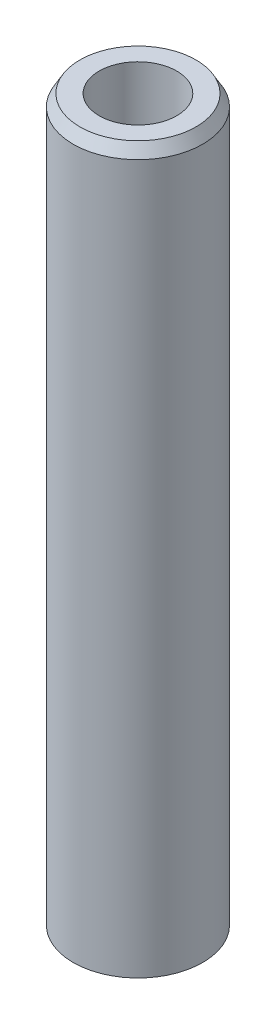
from build123d import *
from OCP.BRepFilletAPI import BRepFilletAPI_MakeChamfer

# Parameters (mm, degrees)
SKETCH1_R           = 30
BOSS_EXTRUDE1_DEPTH = 336.736956736
SKETCH2_R           = 17.9678522
CUT_EXTRUDE1_DEPTH  = 340.39914265
CHAMFER1_SIZE       = 5.389514011
CHAMFER1_SIZE2      = 3.111637365


with BuildPart() as part:
    # Sketch1 → Boss-Extrude1 (new body)
    with BuildSketch(Plane(origin=(0, 0, 0), x_dir=(1, 0, 0), z_dir=(0, 1, 0))):
        Circle(SKETCH1_R)
    extrude(amount=BOSS_EXTRUDE1_DEPTH)

    # Sketch2 → Cut-Extrude1 (cut, through all)
    with BuildSketch(Plane(origin=(0, 0, 0), x_dir=(1, 0, 0), z_dir=(0, 1, 0))):
        Circle(SKETCH2_R)
    extrude(amount=CUT_EXTRUDE1_DEPTH, mode=Mode.SUBTRACT)

    # Chamfer1: one chamfer whose edges measure the first distance from different faces: ONE call of the kernel's chamfer builder (chamfer() names one face for all edges)
    chamfer1_edges_1 = [part.edges().sort_by_distance(p)[0] for p in [
        (-30, 336.736956736, 0),
    ]]
    chamfer1_side_1 = [part.faces().sort_by_distance(p)[0] for p in [
        (-30, 168.368478368, 0),
    ]]
    chamfer1_edges_2 = [part.edges().sort_by_distance(p)[0] for p in [
        (-30, 0, 0),
    ]]
    chamfer1_side_2 = [part.faces().sort_by_distance(p)[0] for p in [
        (-29.151471863, 0, 0),
    ]]
    chamfer1 = BRepFilletAPI_MakeChamfer(part.part.solid().wrapped)
    for e in chamfer1_edges_1:
        chamfer1.Add(CHAMFER1_SIZE, CHAMFER1_SIZE2, e.wrapped, chamfer1_side_1[0].wrapped)  # the first distance lies on this face
    for e in chamfer1_edges_2:
        chamfer1.Add(CHAMFER1_SIZE, CHAMFER1_SIZE2, e.wrapped, chamfer1_side_2[0].wrapped)  # the first distance lies on this face
    add(Compound.cast(chamfer1.Shape()), mode=Mode.REPLACE)


solid = part.part
